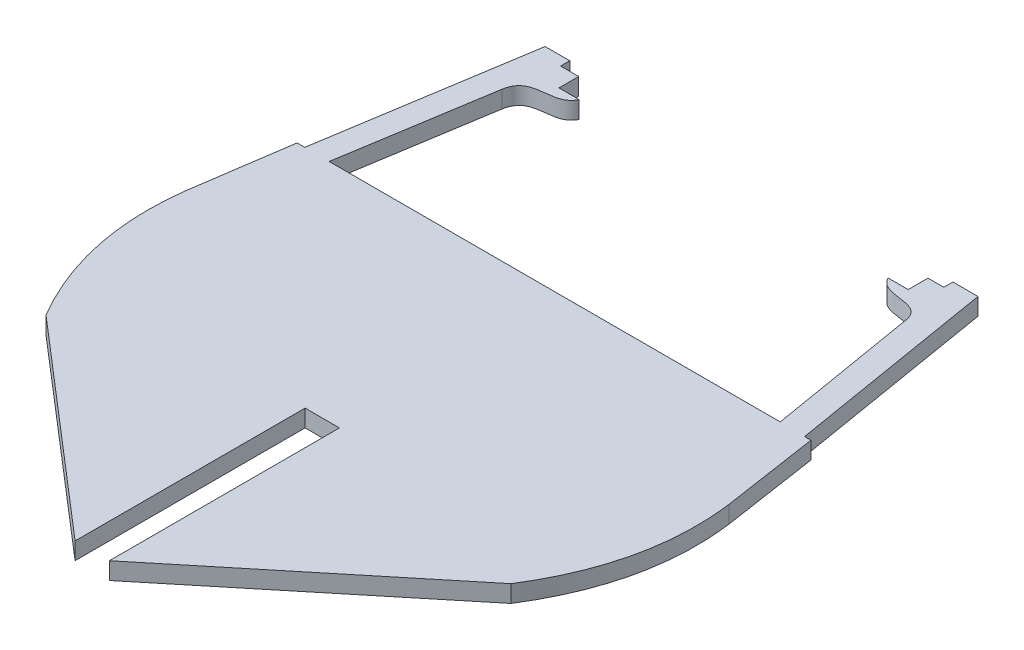
from build123d import *

# Parameters (mm, degrees)
EXTRUDE_1_DEPTH = 4


with BuildPart() as part:
    # 草图1 → 凸台-拉伸1 (new body)
    with BuildSketch(Plane(origin=(0, 0, 0), x_dir=(1, 0, 0), z_dir=(0, 1, 0))):
        with BuildLine():
            Line((-191.5598571, -195.361767882), (-296.68309945, -195.361767882))
            Line((-296.68309945, -195.361767882), (-291.135323467, -160.65260532))
            add(Edge.make_bspline(
                [(-280.034037848, -153.736125574), (-282.386693426, -158.472496319), (-289.975491331, -153.963294092), (-291.135323467, -160.65260532)],
                knots=[0, 0, 0, 0, 1, 1, 1, 1], degree=3))
            Line((-280.034037848, -153.736125574), (-284.760388156, -153.736125574))
            Line((-284.760388156, -153.736125574), (-284.760388156, -149.130301354))
            Line((-284.760388156, -149.130301354), (-288.975781675, -149.130301354))
            Line((-288.975781675, -149.130301354), (-288.975781675, -146.996541361))
            Line((-288.975781675, -146.996541361), (-294.724045564, -146.996541361))
            Line((-294.724045564, -146.996541361), (-302.388397416, -195.361767882))
            Line((-302.388397416, -195.361767882), (-304.176746181, -195.361767882))
            Line((-304.176746181, -195.361767882), (-307.497965317, -217.979623814))
            add(Edge.make_bspline(
                [(-307.497965317, -217.979623814), (-310.266242155, -239.788111984), (-298.67209919, -259.372523892)],
                knots=[0, 0, 0, 1, 1, 1], degree=2))
            Line((-298.67209919, -259.372523892), (-249.715015857, -301.548357225))
            Line((-249.715015857, -301.548357225), (-249.715015857, -247.941690559))
            Line((-249.715015857, -247.941690559), (-241.715015857, -247.941690559))
            Line((-241.715015857, -247.941690559), (-241.715015857, -301.548357225))
            Line((-241.715015857, -301.548357225), (-190.272501078, -259.372523892))
            add(Edge.make_bspline(
                [(-180.891057132, -217.979623814), (-178.010565894, -239.895482711), (-190.272501078, -259.372523892)],
                knots=[0, 0, 0, 1, 1, 1], degree=2))
            Line((-180.891057132, -217.979623814), (-184.286742575, -195.483207754))
            Line((-184.286742575, -195.483207754), (-185.763727832, -195.483207754))
            Line((-185.763727832, -195.483207754), (-193.83586776, -146.996541361))
            Line((-193.83586776, -146.996541361), (-199.668145075, -146.996541361))
            Line((-199.668145075, -146.996541361), (-199.668145075, -149.130301354))
            Line((-199.668145075, -149.130301354), (-203.366662398, -149.130301354))
            Line((-203.366662398, -149.130301354), (-203.366662398, -153.736125574))
            Line((-203.366662398, -153.736125574), (-208.060934383, -153.736125574))
            add(Edge.make_bspline(
                [(-208.060934383, -153.736125574), (-205.653842907, -158.457513823), (-198.111242494, -154.183682512), (-197.392134416, -160.65260532)],
                knots=[0, 0, 0, 0, 1, 1, 1, 1], degree=3))
            Line((-197.392134416, -160.65260532), (-191.5598571, -195.361767882))
        make_face()
    extrude(amount=EXTRUDE_1_DEPTH)


solid = part.part
